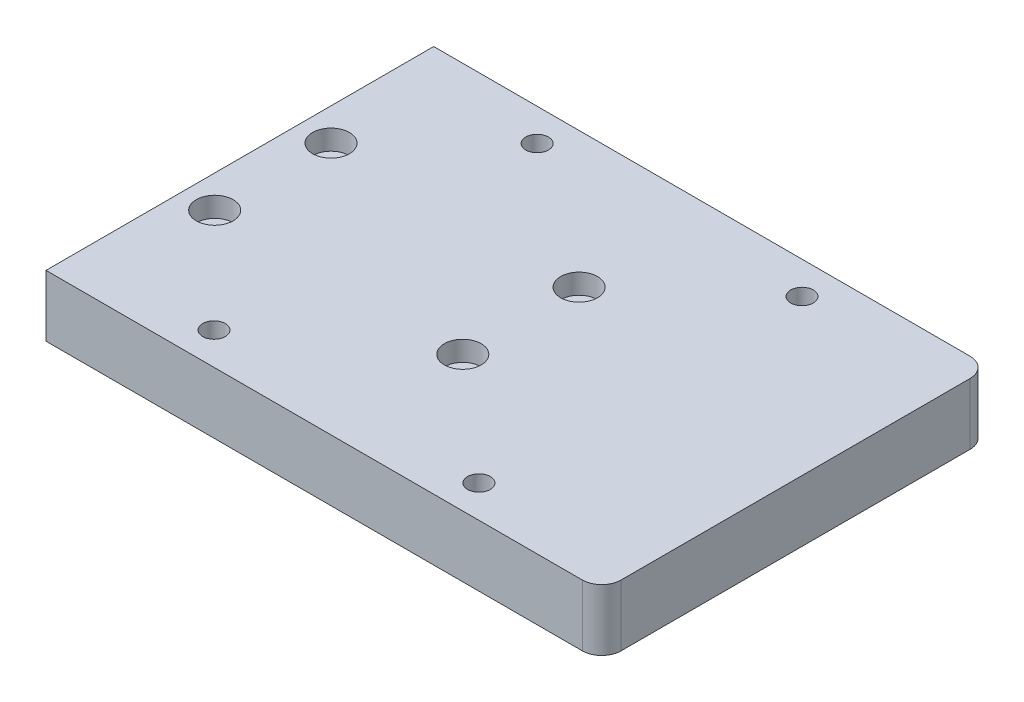
from build123d import *

# Parameters (mm, degrees)
SKETCH_1_W          = 86
SKETCH_1_H          = 60
EXTRUDE_1_DEPTH     = 9.5
FILLET_1_R          = 3
SKETCH_2_R          = 1.25
CUT_EXTRUDE_1_DEPTH = 54.284613164
SKETCH_3_R          = 2.85
CUT_EXTRUDE_2_DEPTH = 3.1
SKETCH_4_R          = 1.75
CUT_EXTRUDE_3_DEPTH = 54.284613164


with BuildPart() as part:
    # 草图1 → 凸台-拉伸1 (new body)
    with BuildSketch(Plane(origin=(0, 0, 0), x_dir=(1, 0, 0), z_dir=(0, 1, 0))):
        Rectangle(SKETCH_1_W, SKETCH_1_H)
    extrude(amount=EXTRUDE_1_DEPTH)

    # 圆角1
    fillet_1_edges = [part.edges().sort_by_distance(p)[0] for p in [
        (43, 4.75, -30),
        (43, 4.75, 30),
    ]]
    fillet(fillet_1_edges, radius=FILLET_1_R)

    # 草图2 → 切除-拉伸1 (cut, through all)
    with BuildSketch(Plane(origin=(0, 9.5, 0), x_dir=(1, 0, 0), z_dir=(0, 1, 0))):
        with Locations((-38, -8.88983487)):
            Circle(SKETCH_2_R)
        with Locations((-38, 9.11016513)):
            Circle(SKETCH_2_R)
        with Locations((0.5, 9)):
            Circle(SKETCH_2_R)
        with Locations((0.5, -9)):
            Circle(SKETCH_2_R)
    extrude(amount=-CUT_EXTRUDE_1_DEPTH, mode=Mode.SUBTRACT)

    # 草图3 → 切除-拉伸2 (cut)
    with BuildSketch(Plane(origin=(0, 9.5, 0), x_dir=(1, 0, 0), z_dir=(0, 1, 0))):
        with Locations((-38, -8.88983487)):
            Circle(SKETCH_3_R)
        with Locations((-38, 9.11016513)):
            Circle(SKETCH_3_R)
        with Locations((0.5, -9)):
            Circle(SKETCH_3_R)
        with Locations((0.5, 9)):
            Circle(SKETCH_3_R)
    extrude(amount=-CUT_EXTRUDE_2_DEPTH, mode=Mode.SUBTRACT)

    # 草图4 → 切除-拉伸3 (cut, through all)
    with BuildSketch(Plane(origin=(0, 9.5, 0), x_dir=(1, 0, 0), z_dir=(0, 1, 0))):
        with Locations((-22, -25)):
            Circle(SKETCH_4_R)
        with Locations((-22, 25)):
            Circle(SKETCH_4_R)
        with Locations((19, -25)):
            Circle(SKETCH_4_R)
        with Locations((19, 25)):
            Circle(SKETCH_4_R)
    extrude(amount=-CUT_EXTRUDE_3_DEPTH, mode=Mode.SUBTRACT)


solid = part.part
